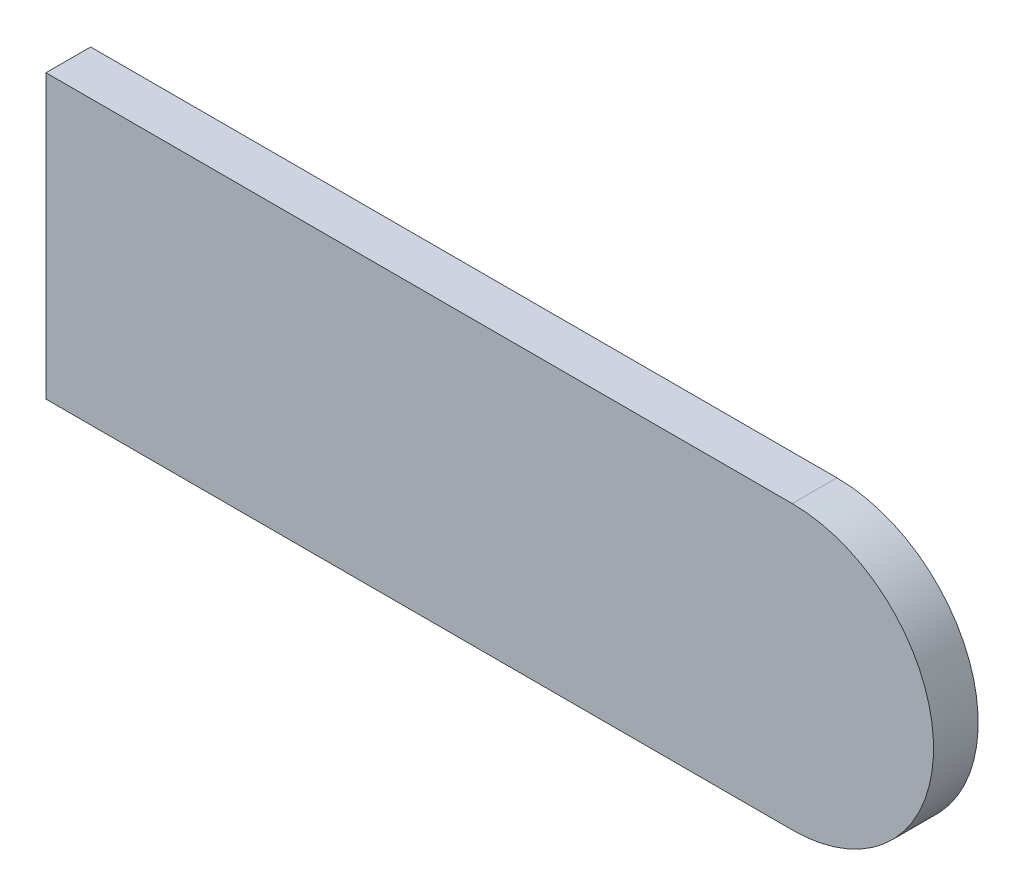
from build123d import *

# Parameters (mm, degrees)
BOSS_EXTRUDE1_DEPTH = 3


with BuildPart() as part:
    # Sketch1 → Boss-Extrude1 (new body)
    with BuildSketch(Plane.XY):
        with BuildLine():
            Line((-50.157635809, -9.5), (0, -9.5))
            ThreePointArc((0, -9.5), (9.5, 0), (0, 9.5))
            Line((0, 9.5), (-50.157635809, 9.5))
            Line((-50.157635809, 9.5), (-50.157635809, -9.5))
        make_face()
    extrude(amount=BOSS_EXTRUDE1_DEPTH)


solid = part.part
